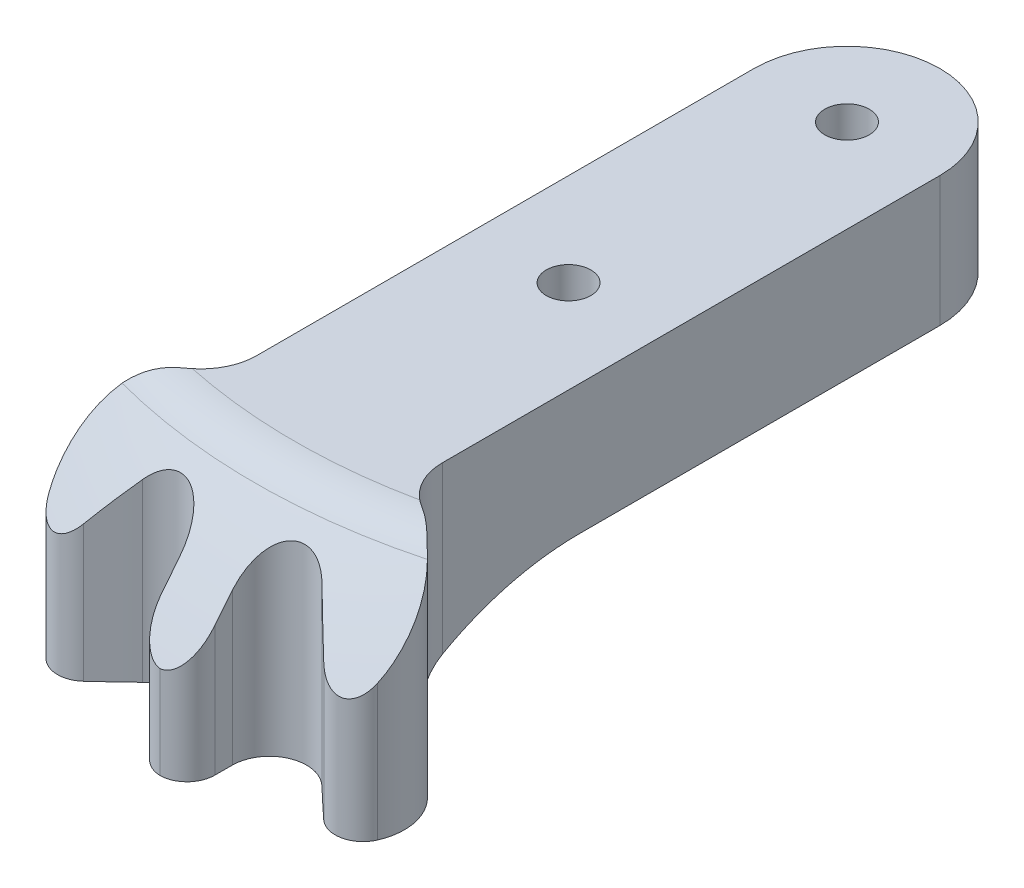
from build123d import *
from build123d.topology import SkipClean

# Parameters (mm, degrees)
ESQUISSE1_R             = 1.2
BOSS_EXTRU_1_DEPTH      = 12
BOSS_EXTRU_2_DEPTH      = 12
ESQUISSE3_OUTSIDE_W     = 37.484
ESQUISSE3_OUTSIDE_H     = 73.419
ENL_V_MAT_EXTRU_1_DEPTH = 170.970209289
CONG_2_R                = 3
CONG_1_R                = 1.5
ESQUISSE7_W             = 0.946782305
ESQUISSE7_H             = 12
ENL_V_MAT_EXTRU_5_DEPTH = 15
CONG_3_R                = 1.5
ENL_V_MAT_EXTRU_3_DEPTH = 2
CONG_4_R                = 3


with BuildPart() as part:
    # Esquisse1 → Boss.-Extru.1 (new body)
    with BuildSketch(Plane(origin=(0, 0, 0), x_dir=(1, 0, 0), z_dir=(0, 1, 0))):
        with BuildLine():
            Line((5, -115), (5, -146))
            Line((5, -146), (-5, -146))
            Line((-5, -146), (-5, -115))
            ThreePointArc((-5, -115), (0, -110), (5, -115))
        make_face()
        with Locations(Location((0, -115, 0), (0, 0, 270))):
            Circle(ESQUISSE1_R, mode=Mode.SUBTRACT)
        with Locations(Location((0, -130, 0), (0, 0, 270))):
            Circle(ESQUISSE1_R, mode=Mode.SUBTRACT)
    extrude(amount=-BOSS_EXTRU_1_DEPTH)

    # Esquisse2 → Boss.-Extru.2 (add)
    with BuildSketch(Plane(origin=(0, 0, 0), x_dir=(1, 0, 0), z_dir=(0, 1, 0))):
        with BuildLine():
            ThreePointArc((2.297654972, -159.197635973), (2.500096708, -154.365285132), (2.549630638, -149.52894936))
            ThreePointArc((2.549630638, -149.52894936), (-1.115535331, -144.03526605), (-7.609239761, -145.237680564))
            ThreePointArc((-7.609239761, -145.237680564), (-10.72587755, -148.106981091), (-13.96441251, -150.837953067))
            ThreePointArc((-13.96441251, -150.837953067), (-12.257608054, -167.514829553), (2.297654972, -159.197635973))
        make_face()
        with BuildLine():
            ThreePointArc((-11.452932946, -153.951226328), (-8.081311937, -151.108026363), (-4.836597406, -148.1208133))
            ThreePointArc((-4.836597406, -148.1208133), (-2.672029263, -147.720008461), (-1.450307273, -149.551236231))
            ThreePointArc((-1.450307273, -149.551236231), (-1.498545632, -154.261076504), (-1.695692457, -158.967036072))
            ThreePointArc((-1.695692457, -158.967036072), (-10.428850272, -163.95735222), (-11.452932946, -153.951226328))
        make_face(mode=Mode.SUBTRACT)
    extrude(amount=-BOSS_EXTRU_2_DEPTH)

    # Esquisse3 outside → Enlèv. mat.-Extru.1 (cut, through all)
    with BuildSketch(Plane(origin=(0, 0, 0), x_dir=(1, 0, 0), z_dir=(0, 1, 0))):
        with Locations((-6.343, -139.3105)):
            Rectangle(ESQUISSE3_OUTSIDE_W, ESQUISSE3_OUTSIDE_H)
        with BuildLine():
            Line((-13, -140.030172342), (-13, -110))
            Line((-13, -110), (0, -110))
            Line((0, -110), (0, -153.030172342))
            ThreePointArc((0, -153.030172342), (-9.192388155, -149.222560498), (-13, -140.030172342))
        make_face(mode=Mode.SUBTRACT)
    extrude(amount=-ENL_V_MAT_EXTRU_1_DEPTH, mode=Mode.SUBTRACT)

    # Congé2
    cong_2_edges = [part.edges().sort_by_distance(p)[0] for p in [
        (-5, -6, 143.765970759),
        (-10.40524253, -6, 147.823177404),
    ]]
    fillet(cong_2_edges, radius=CONG_2_R)

    # Congé1
    cong_1_edges = [part.edges().sort_by_distance(p)[0] for p in [
        (-7.535402248, -6, 150.623458563),
    ]]
    fillet(cong_1_edges, radius=CONG_1_R)

    # Esquisse5 → Enlèvement de matière-Révolution1 (revolve, cut)
    with BuildSketch(Plane(origin=(0, 0, 0), x_dir=(0, 0, -1), z_dir=(1, 0, 0))):
        with BuildLine():
            Line((-146, -12), (-115, -12))
            Line((-115, -12), (-115, -7))
            Line((-115, -7), (-135, -7))
            ThreePointArc((-135, -7), (-141.041522987, -8.308649429), (-146, -12))
        make_face()
        with BuildLine():
            Line((-146, 0), (-160, 0))
            Line((-160, 0), (-160, -32.619012861))
            ThreePointArc((-160, -32.619012861), (-156.352146256, -14.870773511), (-146, 0))
        make_face()
    revolve(axis=Axis((0, 0, 115), (0, -1, 0)), mode=Mode.SUBTRACT)

    # Symétrie1: part across plane


with BuildPart() as part_1:
    with SkipClean():  # the faces are left unmerged after this step: merging them gives an invalid solid
        add(part.part)
        add(part.part.mirror(Plane(origin=(0, 0, 0), x_dir=(0, 0, 1), z_dir=(1, 0, 0))))

    # Esquisse7 → Enlèv. mat.-Extru.5 (cut)
    with SkipClean():  # the faces are left unmerged after this step: merging them gives an invalid solid
        with BuildSketch(Plane(origin=(5, 0, 0), x_dir=(0, 0, -1), z_dir=(1, 0, 0))):
            with Locations((-152.473391152, -6)):
                Rectangle(ESQUISSE7_W, ESQUISSE7_H)
        extrude(amount=-ENL_V_MAT_EXTRU_5_DEPTH, mode=Mode.SUBTRACT)


with BuildPart() as enl_v_mat_extru_5_kept_piece:
    # of the separate pieces the step leaves, the one the design keeps (enl_v_mat_extru_5_pieces_kept)
    add(part_1.part.solids().sort_by_distance((0, 0, 146))[0])

    # Congé3
    # the kernel refuses this fillet: 1.5 mm, written as the material it takes off along each edge
    with BuildSketch(Plane(origin=(-1.456795034, -15.771881232, 152), x_dir=(0.005830598143572619, 0, -0.9999830019181767), z_dir=(0, 1, 0))) as cong_3_piece_1:
        with BuildLine():
            CenterArc((1.508771432, -1.49998095), CONG_3_R, 90.288765492, 90.045305066)
            Line((0.008796929, -1.508726847), (0, 0))
            ThreePointArc((0, 0), (0.750605801, -0.001891496), (1.501211601, 0))
        make_face()
    extrude(amount=12.495782984, mode=Mode.SUBTRACT)
    with BuildSketch(Plane(origin=(1.456795034, -15.771881232, 152), x_dir=(-1, 0, 0), z_dir=(0, 1, 0))) as cong_3_piece_2:
        with BuildLine():
            CenterArc((1.508752493, -1.5), CONG_3_R, 90, 90.045305066)
            ThreePointArc((0.008752962, -1.501186084), (0.006267945, -0.750582013), (0, 0))
            Line((0, 0), (1.508752493, 0))
        make_face()
    extrude(amount=12.495782984, mode=Mode.SUBTRACT)

    # Esquisse6 → Enlèv. mat.-Extru.3 (cut)
    with BuildSketch(Plane.XZ.offset(7)):
        Polygon((2.75, 116.58771324), (0, 118.175426481), (-2.75, 116.58771324), (-2.75, 113.41228676), (0, 111.824573519), (2.75, 113.41228676), align=None)
        Polygon((2.75, 131.58771324), (0, 133.175426481), (-2.75, 131.58771324), (-2.75, 128.41228676), (0, 126.824573519), (2.75, 128.41228676), align=None)
    extrude(amount=-ENL_V_MAT_EXTRU_3_DEPTH, mode=Mode.SUBTRACT)

    # Congé4
    cong_4_edges = [enl_v_mat_extru_5_kept_piece.edges().sort_by_distance(p)[0] for p in [
        (-3.75326222, -12, 145.771951883),
        (0, 0, 146),
    ]]
    fillet(cong_4_edges, radius=CONG_4_R)


solid = enl_v_mat_extru_5_kept_piece.part
